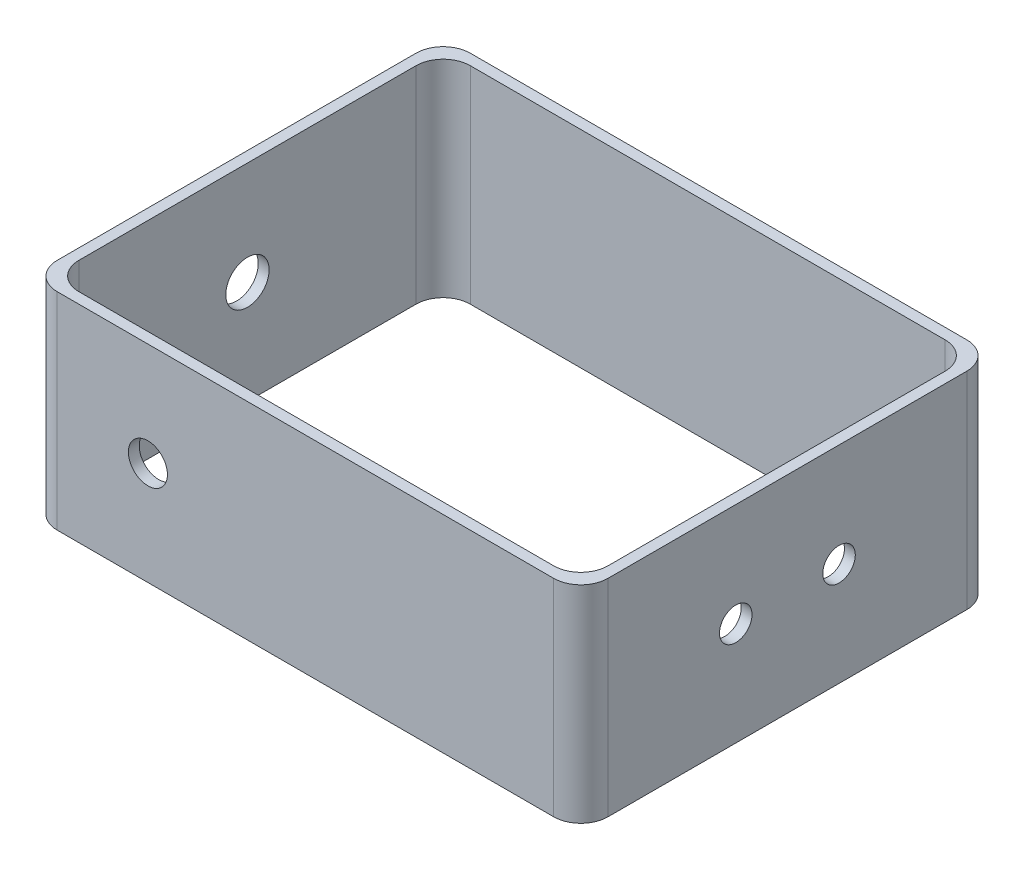
from build123d import *

# Parameters (mm, degrees)
SKETCH1_W           = 101.6
SKETCH1_H           = 76.2
BOSS_EXTRUDE1_DEPTH = 38.1
SKETCH3_W           = 97.6
SKETCH3_H           = 72.2
CUT_EXTRUDE1_DEPTH  = 75.053089065
SKETCH7_R           = 3
CUT_EXTRUDE2_DEPTH  = 2
SKETCH9_R           = 4
CUT_EXTRUDE3_DEPTH  = 2
SKETCH11_R          = 3.6
CUT_EXTRUDE4_DEPTH  = 2
FILLET1_R           = 5
FILLET2_R           = 5


with BuildPart() as part:
    # Sketch1 → Boss-Extrude1 (new body)
    with BuildSketch(Plane(origin=(0, 0, 0), x_dir=(1, 0, 0), z_dir=(0, 1, 0))):
        Rectangle(SKETCH1_W, SKETCH1_H)
    extrude(amount=BOSS_EXTRUDE1_DEPTH)

    # Sketch3 → Cut-Extrude1 (cut, through all)
    with BuildSketch(Plane(origin=(0, 38.1, 0), x_dir=(1, 0, 0), z_dir=(0, 1, 0))):
        Rectangle(SKETCH3_W, SKETCH3_H)
    extrude(amount=-CUT_EXTRUDE1_DEPTH, mode=Mode.SUBTRACT)

    # Sketch7 → Cut-Extrude2 (cut)
    with BuildSketch(Plane(origin=(50.8, 0, 0), x_dir=(0, 0, -1), z_dir=(1, 0, 0))):
        with Locations((-9.525, 19.05)):
            Circle(SKETCH7_R)
        with Locations((9.525, 19.05)):
            Circle(SKETCH7_R)
    extrude(amount=-CUT_EXTRUDE2_DEPTH, mode=Mode.SUBTRACT)

    # Sketch9 → Cut-Extrude3 (cut)
    with BuildSketch(Plane.ZY.offset(50.8)):
        with Locations((0, 19.05)):
            Circle(SKETCH9_R)
    extrude(amount=-CUT_EXTRUDE3_DEPTH, mode=Mode.SUBTRACT)

    # Sketch11 → Cut-Extrude4 (cut)
    with BuildSketch(Plane.XY.offset(38.1)):
        with Locations((-29.061160139, 19.05)):
            Circle(SKETCH11_R)
    extrude(amount=-CUT_EXTRUDE4_DEPTH, mode=Mode.SUBTRACT)

    # Fillet1
    fillet1_edges = [part.edges().sort_by_distance(p)[0] for p in [
        (-50.8, 19.05, 38.1),
        (-50.8, 19.05, -38.1),
        (50.8, 19.05, -38.1),
        (50.8, 19.05, 38.1),
    ]]
    fillet(fillet1_edges, radius=FILLET1_R)

    # Fillet2
    fillet2_edges = [part.edges().sort_by_distance(p)[0] for p in [
        (48.8, 19.05, -36.1),
        (48.8, 19.05, 36.1),
        (-48.8, 19.05, -36.1),
        (-48.8, 19.05, 36.1),
    ]]
    fillet(fillet2_edges, radius=FILLET2_R)


solid = part.part
